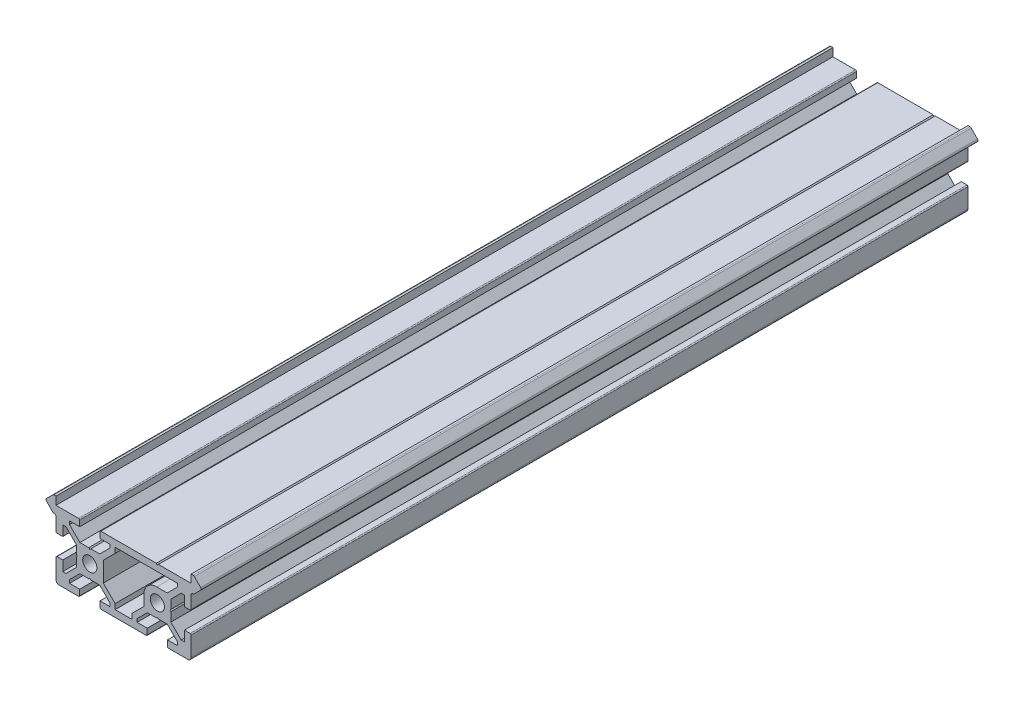
from build123d import *

# Parameters (mm, degrees)
MODEL_R             = 2.100000001
BOSS_EXTRUDE1_DEPTH = 230


with BuildPart() as part:
    # Model → Boss-Extrude1 (new body)
    with BuildSketch(Plane.XY):
        with BuildLine():
            Line((28.771485975, 48.105572105), (30.646485975, 49.980572105))
            ThreePointArc((30.646485975, 49.980572105), (30.808697649, 50.08895848), (31.000039365, 50.127018713))
            Line((31.000039365, 50.127018713), (31.592932584, 50.127018713))
            Line((31.592932584, 50.127018713), (31.592932584, 47.752018713))
            Line((31.592932584, 47.752018713), (38.292932585, 47.752018713))
            ThreePointArc((38.292932585, 47.752018713), (38.505064619, 47.664150748), (38.592932584, 47.452018714))
            Line((38.592932584, 47.452018714), (38.592932584, 45.752018713))
            Line((38.592932584, 45.752018713), (35.592932585, 45.752018713))
            Line((35.592932585, 45.752018713), (35.592932585, 44.812678885))
            Line((35.592932585, 44.812678885), (38.653592756, 41.752018713))
            Line((38.653592756, 41.752018713), (41.292932583, 41.752018713))
            Line((41.292932583, 41.752018713), (41.592932584, 41.452018713))
            Line((41.592932584, 41.452018713), (41.892932586, 41.752018714))
            Line((41.892932586, 41.752018714), (44.532272412, 41.752018714))
            Line((44.532272412, 41.752018714), (47.592932584, 44.812678886))
            Line((47.592932584, 44.812678886), (47.592932584, 45.752018714))
            Line((47.592932584, 45.752018714), (44.592932584, 45.752018714))
            Line((44.592932584, 45.752018714), (44.592932584, 47.452018715))
            ThreePointArc((44.592932584, 47.452018715), (44.68080055, 47.664150749), (44.892932584, 47.752018715))
            Line((44.892932584, 47.752018715), (61.292932583, 47.752018715))
            Line((61.292932583, 47.752018715), (61.592932582, 47.452018715))
            Line((61.592932582, 47.452018715), (61.892932583, 47.752018716))
            Line((61.892932583, 47.752018716), (71.592932583, 47.752018716))
            Line((71.592932583, 47.752018716), (71.592932583, 50.127018711))
            Line((71.592932583, 50.127018711), (72.185825802, 50.127018711))
            ThreePointArc((72.185825802, 50.127018711), (72.377167518, 50.088958477), (72.539379192, 49.980572102))
            Line((72.539379192, 49.980572102), (74.414379192, 48.105572102))
            ThreePointArc((74.414379192, 48.105572102), (74.560825801, 47.752018712), (74.414379192, 47.398465322))
            Line((74.414379192, 47.398465322), (72.539379192, 45.523465322))
            ThreePointArc((72.539379192, 45.523465322), (72.377167518, 45.415078947), (72.185825802, 45.377018714))
            Line((72.185825802, 45.377018714), (72.092932582, 45.377018714))
            ThreePointArc((72.092932582, 45.377018714), (71.739379192, 45.230572103), (71.592932583, 44.877018713))
            Line((71.592932583, 44.877018713), (71.592932583, 41.052018712))
            ThreePointArc((71.592932583, 41.052018712), (71.505064617, 40.839886678), (71.292932581, 40.752018713))
            Line((71.292932581, 40.752018713), (69.592932583, 40.752018713))
            Line((69.592932583, 40.752018713), (69.592932583, 43.752018712))
            Line((69.592932583, 43.752018712), (68.653592755, 43.752018712))
            Line((68.653592755, 43.752018712), (65.592932583, 40.691358541))
            Line((65.592932583, 40.691358541), (65.592932583, 38.052018712))
            Line((65.592932583, 38.052018712), (65.292932584, 37.752018712))
            Line((65.292932584, 37.752018712), (65.592932583, 37.452018713))
            Line((65.592932583, 37.452018713), (65.592932583, 34.812678884))
            Line((65.592932583, 34.812678884), (68.653592755, 31.752018712))
            Line((68.653592755, 31.752018712), (69.592932583, 31.752018712))
            Line((69.592932583, 31.752018712), (69.592932583, 34.752018711))
            Line((69.592932583, 34.752018711), (71.292932581, 34.752018711))
            ThreePointArc((71.292932581, 34.752018711), (71.505064617, 34.664150747), (71.592932583, 34.452018712))
            Line((71.592932583, 34.452018712), (71.592932583, 28.75201871))
            ThreePointArc((71.592932583, 28.75201871), (71.300039364, 28.044911929), (70.592932582, 27.752018711))
            Line((70.592932582, 27.752018711), (64.892932582, 27.752018711))
            ThreePointArc((64.892932582, 27.752018711), (64.680800548, 27.839886676), (64.592932583, 28.05201871))
            Line((64.592932583, 28.05201871), (64.592932583, 29.752018711))
            Line((64.592932583, 29.752018711), (67.592932582, 29.752018711))
            Line((67.592932582, 29.752018711), (67.592932582, 30.69135854))
            Line((67.592932582, 30.69135854), (64.532272411, 33.752018711))
            Line((64.532272411, 33.752018711), (61.892932584, 33.752018711))
            Line((61.892932584, 33.752018711), (61.592932582, 34.052018713))
            Line((61.592932582, 34.052018713), (61.292932582, 33.752018712))
            Line((61.292932582, 33.752018712), (58.653592755, 33.752018712))
            Line((58.653592755, 33.752018712), (55.592932583, 30.691358541))
            Line((55.592932583, 30.691358541), (55.592932583, 29.752018713))
            Line((55.592932583, 29.752018713), (58.592932583, 29.752018713))
            Line((58.592932583, 29.752018713), (58.592932583, 28.052018712))
            ThreePointArc((58.592932583, 28.052018712), (58.505064617, 27.839886678), (58.292932583, 27.752018712))
            Line((58.292932583, 27.752018712), (44.892932584, 27.752018712))
            ThreePointArc((44.892932584, 27.752018712), (44.68080055, 27.839886678), (44.592932584, 28.052018712))
            Line((44.592932584, 28.052018712), (44.592932584, 29.752018713))
            Line((44.592932584, 29.752018713), (47.592932584, 29.752018713))
            Line((47.592932584, 29.752018713), (47.592932584, 30.691358541))
            Line((47.592932584, 30.691358541), (44.532272412, 33.752018712))
            Line((44.532272412, 33.752018712), (41.892932586, 33.752018712))
            Line((41.892932586, 33.752018712), (41.592932584, 34.052018714))
            Line((41.592932584, 34.052018714), (41.292932583, 33.752018714))
            Line((41.292932583, 33.752018714), (38.653592756, 33.752018714))
            Line((38.653592756, 33.752018714), (35.592932585, 30.691358542))
            Line((35.592932585, 30.691358542), (35.592932585, 29.752018714))
            Line((35.592932585, 29.752018714), (38.592932584, 29.752018714))
            Line((38.592932584, 29.752018714), (38.592932584, 28.052018713))
            ThreePointArc((38.592932584, 28.052018713), (38.505064619, 27.839886679), (38.292932585, 27.752018714))
            Line((38.292932585, 27.752018714), (32.592932585, 27.752018714))
            ThreePointArc((32.592932585, 27.752018714), (31.885825803, 28.044911931), (31.592932584, 28.752018713))
            Line((31.592932584, 28.752018713), (31.592932584, 34.452018715))
            ThreePointArc((31.592932584, 34.452018715), (31.68080055, 34.664150748), (31.892932583, 34.752018714))
            Line((31.892932583, 34.752018714), (33.592932584, 34.752018714))
            Line((33.592932584, 34.752018714), (33.592932584, 31.752018715))
            Line((33.592932584, 31.752018715), (34.532272412, 31.752018715))
            Line((34.532272412, 31.752018715), (37.592932584, 34.812678886))
            Line((37.592932584, 34.812678886), (37.592932584, 37.452018715))
            Line((37.592932584, 37.452018715), (37.892932583, 37.752018715))
            Line((37.892932583, 37.752018715), (37.592932584, 38.052018714))
            Line((37.592932584, 38.052018714), (37.592932584, 40.691358543))
            Line((37.592932584, 40.691358543), (34.532272412, 43.752018715))
            Line((34.532272412, 43.752018715), (33.592932584, 43.752018715))
            Line((33.592932584, 43.752018715), (33.592932584, 40.752018716))
            Line((33.592932584, 40.752018716), (31.892932586, 40.752018716))
            ThreePointArc((31.892932586, 40.752018716), (31.68080055, 40.83988668), (31.592932584, 41.052018715))
            Line((31.592932584, 41.052018715), (31.592932584, 44.877018715))
            ThreePointArc((31.592932584, 44.877018715), (31.446485975, 45.230572106), (31.092932585, 45.377018716))
            Line((31.092932585, 45.377018716), (31.000039365, 45.377018716))
            ThreePointArc((31.000039365, 45.377018716), (30.808697649, 45.41507895), (30.646485975, 45.523465324))
            Line((30.646485975, 45.523465324), (28.771485975, 47.398465325))
            ThreePointArc((28.771485975, 47.398465325), (28.625039366, 47.752018715), (28.771485975, 48.105572105))
        make_face()
        with Locations((61.592932582, 37.752018715)):
            Circle(MODEL_R, mode=Mode.SUBTRACT)
        with Locations((41.592932582, 37.752018715)):
            Circle(MODEL_R, mode=Mode.SUBTRACT)
        with BuildLine():
            Line((54.092932584, 29.752018715), (49.092932584, 29.752018715))
            Line((49.092932584, 29.752018715), (49.092932584, 31.312678886))
            Line((49.092932584, 31.312678886), (45.592932583, 34.812678886))
            Line((45.592932583, 34.812678886), (45.592932583, 40.691358543))
            Line((45.592932583, 40.691358543), (49.092932584, 44.191358544))
            Line((49.092932584, 44.191358544), (49.092932584, 45.752018714))
            Line((49.092932584, 45.752018714), (67.592932582, 45.752018714))
            Line((67.592932582, 45.752018714), (67.592932582, 44.812678887))
            Line((67.592932582, 44.812678887), (64.532272411, 41.752018716))
            Line((64.532272411, 41.752018716), (61.402932584, 41.752018716))
            ThreePointArc((61.402932584, 41.752018716), (58.708855747, 40.636095552), (57.592932584, 37.942018716))
            Line((57.592932584, 37.942018716), (57.592932584, 34.812678886))
            Line((57.592932584, 34.812678886), (54.092932584, 31.312678886))
            Line((54.092932584, 31.312678886), (54.092932584, 29.752018715))
        make_face(mode=Mode.SUBTRACT)
    extrude(amount=BOSS_EXTRUDE1_DEPTH)


solid = part.part
